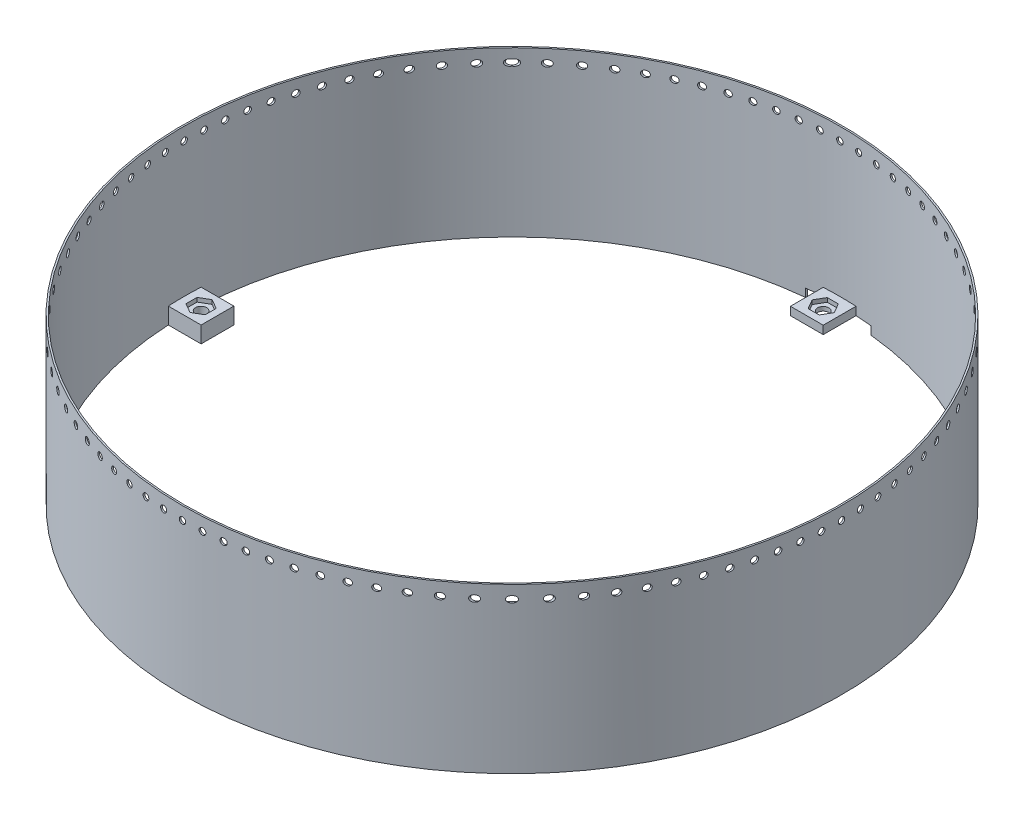
from build123d import *

# Parameters (mm, degrees)
SKETCH1_R           = 127.635
SKETCH1_R_2         = 127
BOSS_EXTRUDE1_DEPTH = 63.5
SKETCH2_R           = 1.25
CUT_EXTRUDE1_DEPTH  = 293.379404413
CIRPATTERN1_COUNT   = 2
CIRPATTERN1_ANGLE   = 90
BOSS_EXTRUDE2_START = -6.35
SKETCH4_R           = 2.159
BOSS_EXTRUDE2_DEPTH = 6.35
SKETCH5_R           = 2.159
CUT_EXTRUDE2_DEPTH  = 1.5875
SKETCH6_W           = 25.4
SKETCH6_H           = 3.175
CUT_EXTRUDE3_DEPTH  = 281.672790182


with BuildPart() as part:
    # Sketch1 → Boss-Extrude1 (new body)
    with BuildSketch(Plane(origin=(0, 0, 0), x_dir=(1, 0, 0), z_dir=(0, 1, 0))):
        Circle(SKETCH1_R)
        Circle(SKETCH1_R_2, mode=Mode.SUBTRACT)
    extrude(amount=-BOSS_EXTRUDE1_DEPTH)

    # Sketch2 → Cut-Extrude1 (cut, through all)
    with BuildSketch(Plane.XY.offset(127.635)):
        with Locations((0, -5)):
            Circle(SKETCH2_R)
        with Locations((7.5184, -5)):
            Circle(SKETCH2_R)
        with Locations((15.0368, -5)):
            Circle(SKETCH2_R)
        with Locations((22.5552, -5)):
            Circle(SKETCH2_R)
        with Locations((30.0736, -5)):
            Circle(SKETCH2_R)
        with Locations((37.592, -5)):
            Circle(SKETCH2_R)
        with Locations((45.1104, -5)):
            Circle(SKETCH2_R)
        with Locations((52.6288, -5)):
            Circle(SKETCH2_R)
        with Locations((60.1472, -5)):
            Circle(SKETCH2_R)
        with Locations((67.6656, -5)):
            Circle(SKETCH2_R)
        with Locations((75.184, -5)):
            Circle(SKETCH2_R)
        with Locations((82.7024, -5)):
            Circle(SKETCH2_R)
        with Locations((90.2208, -5)):
            Circle(SKETCH2_R)
        with Locations((-90.2208, -5)):
            Circle(SKETCH2_R)
        with Locations((-82.7024, -5)):
            Circle(SKETCH2_R)
        with Locations((-75.184, -5)):
            Circle(SKETCH2_R)
        with Locations((-67.6656, -5)):
            Circle(SKETCH2_R)
        with Locations((-60.1472, -5)):
            Circle(SKETCH2_R)
        with Locations((-52.6288, -5)):
            Circle(SKETCH2_R)
        with Locations((-45.1104, -5)):
            Circle(SKETCH2_R)
        with Locations((-37.592, -5)):
            Circle(SKETCH2_R)
        with Locations((-30.0736, -5)):
            Circle(SKETCH2_R)
        with Locations((-22.5552, -5)):
            Circle(SKETCH2_R)
        with Locations((-15.0368, -5)):
            Circle(SKETCH2_R)
        with Locations((-7.5184, -5)):
            Circle(SKETCH2_R)
    cut_extrude1 = extrude(amount=-CUT_EXTRUDE1_DEPTH, mode=Mode.SUBTRACT)

    # CirPattern1: Cut-Extrude1 ×2 about axis
    cirpattern1_axis = Axis((0, -63.5, 0), (0, 1, 0))
    for i in range(1, CIRPATTERN1_COUNT):
        add(cut_extrude1.rotate(cirpattern1_axis, i * CIRPATTERN1_ANGLE / (CIRPATTERN1_COUNT - 1)), mode=Mode.SUBTRACT)

    # Sketch4 → Boss-Extrude2 (add)
    # profile 1 of 4: a face of its own
    with BuildSketch(Plane(origin=(0, -63.5, 0), x_dir=(-1, 0, 0), z_dir=(0, -1, 0)).offset(BOSS_EXTRUDE2_START)):
        with BuildLine():
            Line((-6.290988483, -114.138182624), (-6.290988483, -126.844091167))
            ThreePointArc((-6.290988483, -126.844091167), (0.05908542, -126.999986256), (6.409011517, -126.838182624))
            Line((6.409011517, -126.838182624), (6.409011517, -114.138182624))
            Line((6.409011517, -114.138182624), (-6.290988483, -114.138182624))
        make_face()
        with Locations((0.059011517, -120.488182624)):
            Circle(SKETCH4_R, mode=Mode.SUBTRACT)
    # profile 2 of 4: a face of its own
    with BuildSketch(Plane(origin=(0, -63.5, 0), x_dir=(-1, 0, 0), z_dir=(0, -1, 0)).offset(BOSS_EXTRUDE2_START)):
        with BuildLine():
            ThreePointArc((-126.844091167, 6.290988483), (-126.999986256, -0.05908542), (-126.838182624, -6.409011517))
            Line((-126.838182624, -6.409011517), (-114.138182624, -6.409011517))
            Line((-114.138182624, -6.409011517), (-114.138182624, 6.290988483))
            Line((-114.138182624, 6.290988483), (-126.844091167, 6.290988483))
        make_face()
        with Locations((-120.488182624, -0.059011517)):
            Circle(SKETCH4_R, mode=Mode.SUBTRACT)
    # profile 3 of 4: a face of its own
    with BuildSketch(Plane(origin=(0, -63.5, 0), x_dir=(-1, 0, 0), z_dir=(0, -1, 0)).offset(BOSS_EXTRUDE2_START)):
        with BuildLine():
            Line((114.138182624, -6.290988483), (126.844091167, -6.290988483))
            ThreePointArc((126.844091167, -6.290988483), (126.999986256, 0.05908542), (126.838182624, 6.409011517))
            Line((126.838182624, 6.409011517), (114.138182624, 6.409011517))
            Line((114.138182624, 6.409011517), (114.138182624, -6.290988483))
        make_face()
        with Locations((120.488182624, 0.059011517)):
            Circle(SKETCH4_R, mode=Mode.SUBTRACT)
    # profile 4 of 4: a face of its own
    with BuildSketch(Plane(origin=(0, -63.5, 0), x_dir=(-1, 0, 0), z_dir=(0, -1, 0)).offset(BOSS_EXTRUDE2_START)):
        with BuildLine():
            ThreePointArc((6.290988483, 126.844091167), (-0.05908542, 126.999986256), (-6.409011517, 126.838182624))
            Line((-6.409011517, 126.838182624), (-6.409011517, 114.138182624))
            Line((-6.409011517, 114.138182624), (6.290988483, 114.138182624))
            Line((6.290988483, 114.138182624), (6.290988483, 126.844091167))
        make_face()
        with Locations((-0.059011517, 120.488182624)):
            Circle(SKETCH4_R, mode=Mode.SUBTRACT)
    extrude(amount=BOSS_EXTRUDE2_DEPTH)

    # Sketch5 → Cut-Extrude2 (cut)
    # profile 1 of 4: a face of its own
    with BuildSketch(Plane(origin=(0, -57.15, 0), x_dir=(1, 0, 0), z_dir=(0, 1, 0))):
        Polygon((-120.488182624, -4.226654904), (-116.776686631, -2.083821693), (-116.776686631, 2.201844728), (-120.488182624, 4.344677938), (-124.199678617, 2.201844728), (-124.199678617, -2.083821693), align=None)
    # profile 2 of 4: a face of its own
    with BuildSketch(Plane(origin=(0, -57.15, 0), x_dir=(1, 0, 0), z_dir=(0, 1, 0))):
        Polygon((4.226654904, -120.488182624), (2.083821693, -116.776686631), (-2.201844728, -116.776686631), (-4.344677938, -120.488182624), (-2.201844728, -124.199678617), (2.083821693, -124.199678617), align=None)
        with Locations((-0.059011517, -120.488182624)):
            Circle(SKETCH5_R, mode=Mode.SUBTRACT)
    # profile 3 of 4: a face of its own
    with BuildSketch(Plane(origin=(0, -57.15, 0), x_dir=(1, 0, 0), z_dir=(0, 1, 0))):
        Polygon((-4.226654904, 120.488182624), (-2.083821693, 116.776686631), (2.201844728, 116.776686631), (4.344677938, 120.488182624), (2.201844728, 124.199678617), (-2.083821693, 124.199678617), align=None)
    # profile 4 of 4: a face of its own
    with BuildSketch(Plane(origin=(0, -57.15, 0), x_dir=(1, 0, 0), z_dir=(0, 1, 0))):
        Polygon((120.488182624, 4.226654904), (116.776686631, 2.083821693), (116.776686631, -2.201844728), (120.488182624, -4.344677938), (124.199678617, -2.201844728), (124.199678617, 2.083821693), align=None)
    extrude(amount=-CUT_EXTRUDE2_DEPTH, mode=Mode.SUBTRACT)

    # Sketch6 → Cut-Extrude3 (cut, through all)
    with BuildSketch(Plane.XY.offset(-114.138182624)):
        with Locations((0.059011517, -61.9125)):
            Rectangle(SKETCH6_W, SKETCH6_H)
    extrude(amount=-CUT_EXTRUDE3_DEPTH, mode=Mode.SUBTRACT)


solid = part.part
